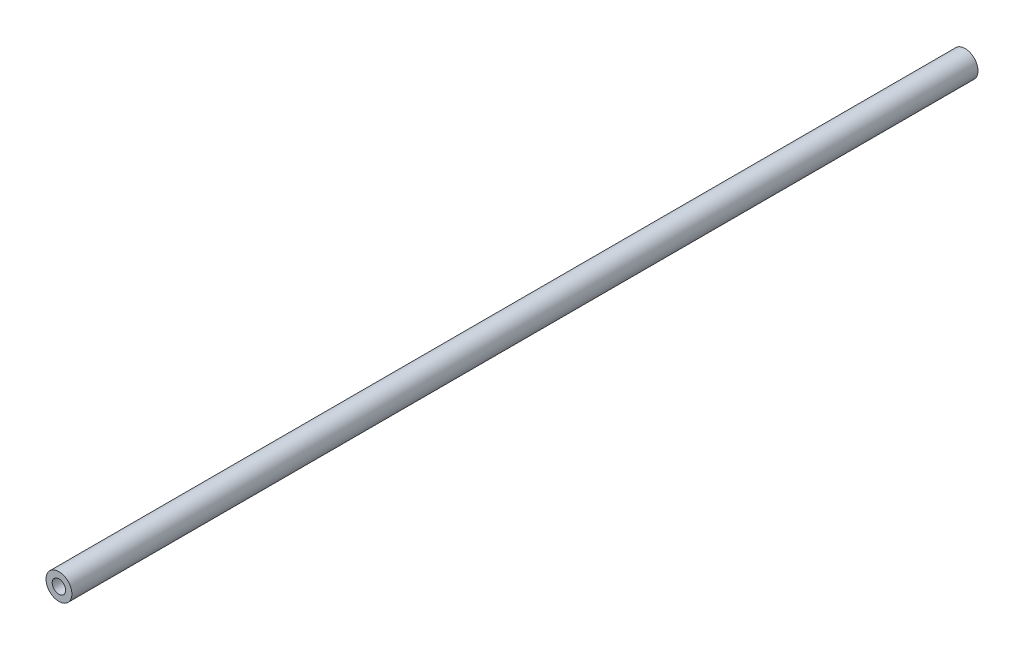
from build123d import *

# Parameters (mm, degrees)
SKETCH1_R                      = 5
BOSS_EXTRUDE1_DEPTH            = 350
F_6_0_204_DIAMETER_HOLE1_D     = 5.1816
F_6_0_204_DIAMETER_HOLE1_DEPTH = 30
F_6_0_204_DIAMETER_HOLE1_TIP   = 1.556709692
F_6_0_204_DIAMETER_HOLE2_D     = 5.1816
F_6_0_204_DIAMETER_HOLE2_DEPTH = 30
F_6_0_204_DIAMETER_HOLE2_TIP   = 1.556709692


with BuildPart() as part:
    # Sketch1 → Boss-Extrude1 (new body)
    with BuildSketch(Plane.XY):
        Circle(SKETCH1_R)
    extrude(amount=BOSS_EXTRUDE1_DEPTH)

    # #6 (0.204) Diameter Hole1
    with Locations(Plane(origin=(0, 0, 0), x_dir=(-1, 0, 0), z_dir=(0, 0, -1))):
        with Locations((0, 0)):
            Hole(F_6_0_204_DIAMETER_HOLE1_D / 2, depth=F_6_0_204_DIAMETER_HOLE1_DEPTH)
            with Locations((0, 0, -(F_6_0_204_DIAMETER_HOLE1_DEPTH + F_6_0_204_DIAMETER_HOLE1_TIP / 2))):  # 118° drill point
                Cone(0, F_6_0_204_DIAMETER_HOLE1_D / 2, F_6_0_204_DIAMETER_HOLE1_TIP, mode=Mode.SUBTRACT)

    # #6 (0.204) Diameter Hole2
    with Locations(Plane.XY.offset(350)):
        with Locations((0, 0)):
            Hole(F_6_0_204_DIAMETER_HOLE2_D / 2, depth=F_6_0_204_DIAMETER_HOLE2_DEPTH)
            with Locations((0, 0, -(F_6_0_204_DIAMETER_HOLE2_DEPTH + F_6_0_204_DIAMETER_HOLE2_TIP / 2))):  # 118° drill point
                Cone(0, F_6_0_204_DIAMETER_HOLE2_D / 2, F_6_0_204_DIAMETER_HOLE2_TIP, mode=Mode.SUBTRACT)


solid = part.part
